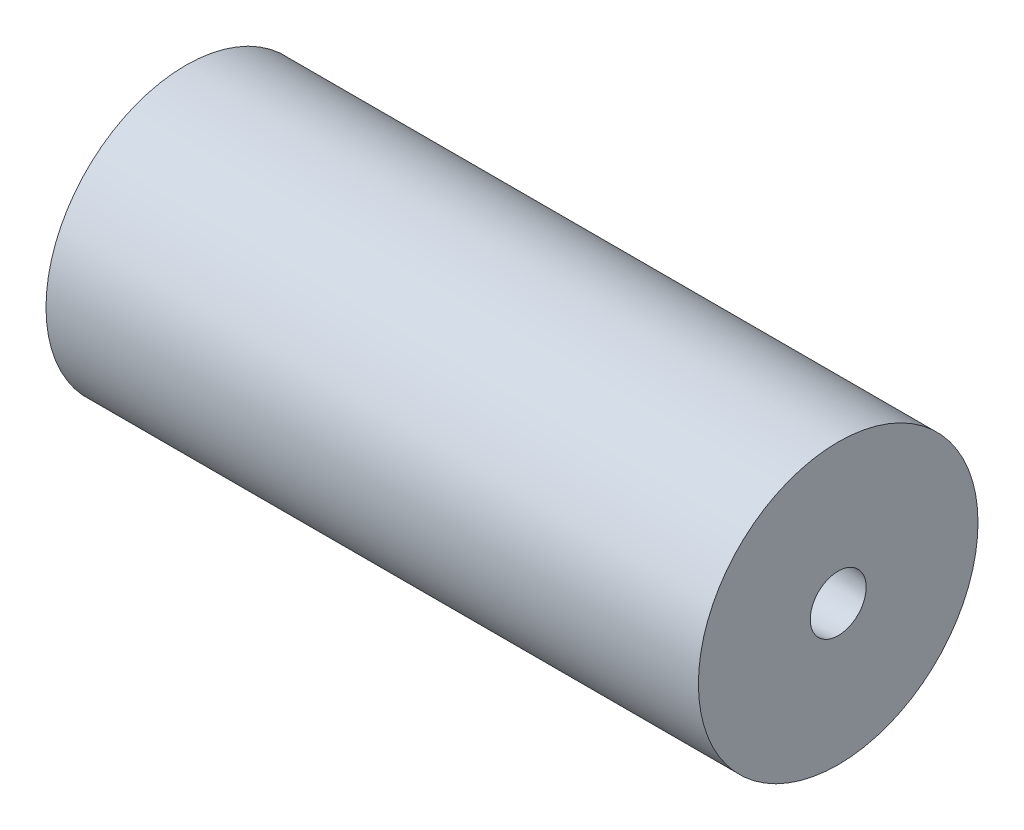
from build123d import *


with BuildPart() as part:
    # Sketch1 → Revolve1 (revolve)
    with BuildSketch(Plane.XY):
        Polygon((-22.225, 9.525), (-22.225, 5.013246791), (22.225, 1.905), (22.225, 9.525), align=None)
    revolve(axis=Axis((-22.225, 0, 0), (1, 0, 0)))


solid = part.part
